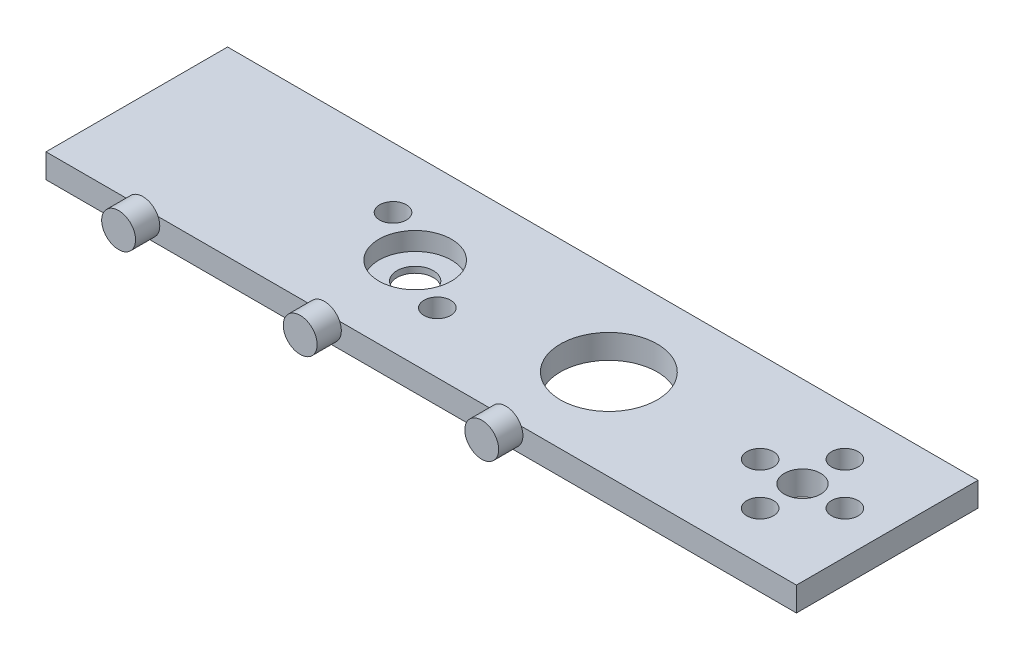
from build123d import *

# Parameters (mm, degrees)
SKETCH_1_W          = 62
SKETCH_1_H          = 15
SKETCH_1_R          = 1.1
SKETCH_1_R_2        = 1.5
SKETCH_1_R_3        = 4
EXTRUDE_1_DEPTH     = 2
SKETCH_2_R          = 1.4
EXTRUDE_2_DEPTH     = 2
SKETCH_4_R          = 3
CUT_EXTRUDE_1_DEPTH = 1.5


with BuildPart() as part:
    # 草图1 → 凸台-拉伸1 (new body)
    with BuildSketch(Plane(origin=(0, 0, 0), x_dir=(1, 0, 0), z_dir=(0, 1, 0))):
        Rectangle(SKETCH_1_W, SKETCH_1_H)
        with Locations((-3.669872981, -2.5)):
            Circle(SKETCH_1_R, mode=Mode.SUBTRACT)
        with Locations((24, -3.5)):
            Circle(SKETCH_1_R, mode=Mode.SUBTRACT)
        with Locations((-8, 0)):
            Circle(SKETCH_1_R_2, mode=Mode.SUBTRACT)
        with Locations((-12.330127019, 2.5)):
            Circle(SKETCH_1_R, mode=Mode.SUBTRACT)
        with Locations((8, 0)):
            Circle(SKETCH_1_R_3, mode=Mode.SUBTRACT)
        with Locations((20.5, 0)):
            Circle(SKETCH_1_R, mode=Mode.SUBTRACT)
        with Locations((24, 0)):
            Circle(SKETCH_1_R_2, mode=Mode.SUBTRACT)
        with Locations((27.5, 0)):
            Circle(SKETCH_1_R, mode=Mode.SUBTRACT)
        with Locations((24, 3.5)):
            Circle(SKETCH_1_R, mode=Mode.SUBTRACT)
    extrude(amount=EXTRUDE_1_DEPTH)

    # 草图2 → 凸台-拉伸2 (add)
    with BuildSketch(Plane.XY.offset(7.5)):
        with Locations((-23, 1.4)):
            Circle(SKETCH_2_R)
        with Locations((-8, 1.4)):
            Circle(SKETCH_2_R)
        with Locations((7, 1.4)):
            Circle(SKETCH_2_R)
    extrude(amount=EXTRUDE_2_DEPTH)

    # 草图4 → 切除-拉伸1 (cut)
    with BuildSketch(Plane(origin=(0, 2, 0), x_dir=(1, 0, 0), z_dir=(0, 1, 0))):
        with Locations((-8, 0)):
            Circle(SKETCH_4_R)
    extrude(amount=-CUT_EXTRUDE_1_DEPTH, mode=Mode.SUBTRACT)


solid = part.part
